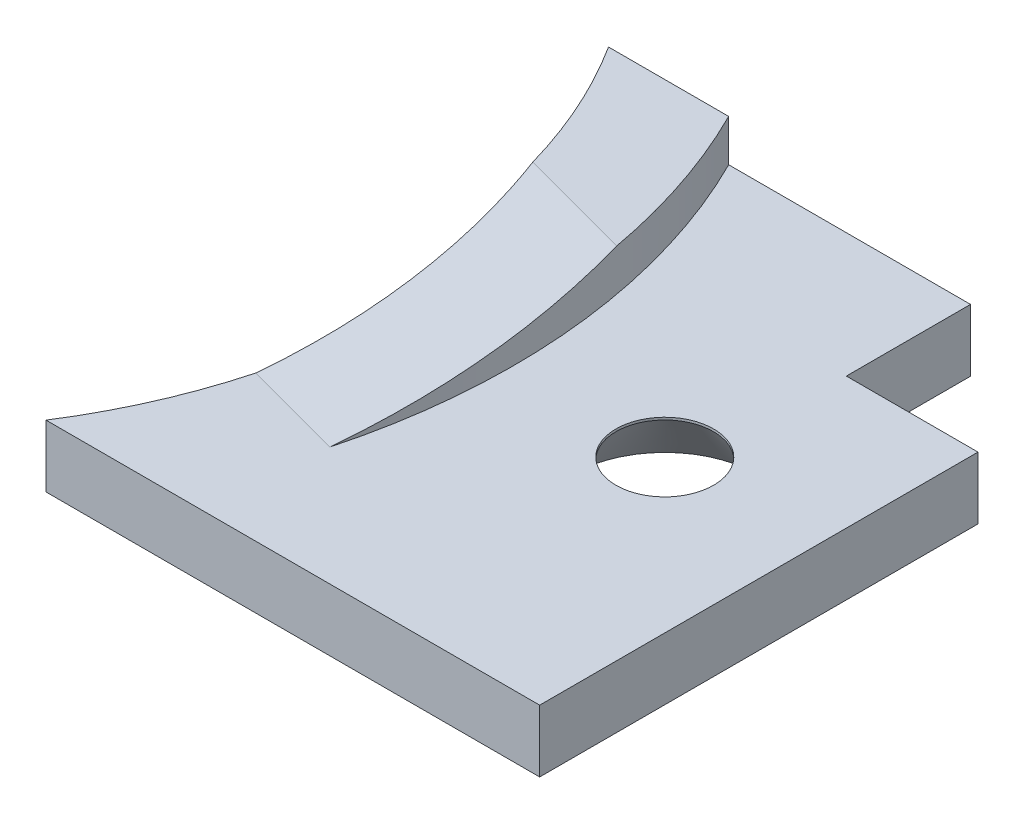
from build123d import *

# Parameters (mm, degrees)
SKETCH1_R           = 1.631999871
BOSS_EXTRUDE1_DEPTH = 2.08
BOSS_EXTRUDE2_DEPTH = 1.4
CHAMFER1_SIZE       = 9
CHAMFER1_SIZE_2     = 1.4
CHAMFER2_SIZE       = 2
CHAMFER2_SIZE2      = 1.5


with BuildPart() as part:
    # Sketch1 → Boss-Extrude1 (new body)
    with BuildSketch(Plane(origin=(0, 0, 0), x_dir=(1, 0, 0), z_dir=(0, 1, 0))):
        with BuildLine():
            Line((-4.4, 14.65), (-4.4, 18.8))
            Line((-4.4, 18.8), (-16.5, 18.8))
            ThreePointArc((-16.5, 18.8), (-13.76109752, 9.4), (-16.5, 0))
            Line((-16.5, 0), (0, 0))
            Line((0, 0), (0, 14.65))
            Line((0, 14.65), (-4.4, 14.65))
        make_face()
        with Locations(Location((-5.09, 9.271001493, 0), (0, 0, 270))):
            Circle(SKETCH1_R, mode=Mode.SUBTRACT)
    extrude(amount=BOSS_EXTRUDE1_DEPTH)

    # Sketch2 → Boss-Extrude2 (add)
    with BuildSketch(Plane(origin=(0, 2.08, 0), x_dir=(1, 0, 0), z_dir=(0, 1, 0))):
        with BuildLine():
            Line((-12.482386169, 18.8), (-16.5, 18.8))
            ThreePointArc((-16.5, 18.8), (-13.964523784, 12.06055201), (-14.35739556, 4.870666711))
            Line((-14.35739556, 4.870666711), (-10.976655168, 3.964800053))
            ThreePointArc((-10.976655168, 3.964800053), (-10.36843652, 11.520546233), (-12.482386169, 18.8))
        make_face()
    extrude(amount=BOSS_EXTRUDE2_DEPTH)

    # Chamfer1
    # the kernel refuses this chamfer: 9, 1.4 mm, written as the material it takes off along each edge
    with BuildSketch(Plane(origin=(-36.950124299, 3.48, -10.924370131), x_dir=(0.25881451828946306, 0.005914407767472668, -0.9659089319927389), z_dir=(0.9659258262890682, 0, 0.2588190451025212))) as chamfer1_piece_1_section:
        Polygon((CHAMFER1_SIZE * 0.999982509737, -CHAMFER1_SIZE * 0.00591440776747), (-CHAMFER1_SIZE_2 * 0.00591440776747, -CHAMFER1_SIZE_2 * 0.999982509737), (0, 0), align=None)
    chamfer1_piece_1 = extrude(amount=50.279427829, mode=Mode.PRIVATE)
    chamfer1_piece_1 = split(chamfer1_piece_1, bisect_by=Plane(origin=(-11.82064593, 2.08, -7.576464434), z_dir=(0, 1, 0)), keep=Keep.TOP, mode=Mode.PRIVATE)
    add(chamfer1_piece_1, mode=Mode.SUBTRACT)

    # Chamfer2
    chamfer2_edges = [part.edges().sort_by_distance(p)[0] for p in [
        (-5.09, 0, -10.903001364),
    ]]
    chamfer2_side = [part.faces().sort_by_distance(p)[0] for p in [
        (-5.09, 1.04, -10.903001364),
    ]]
    chamfer(chamfer2_edges, length=CHAMFER2_SIZE, length2=CHAMFER2_SIZE2, reference=chamfer2_side[0])


solid = part.part
